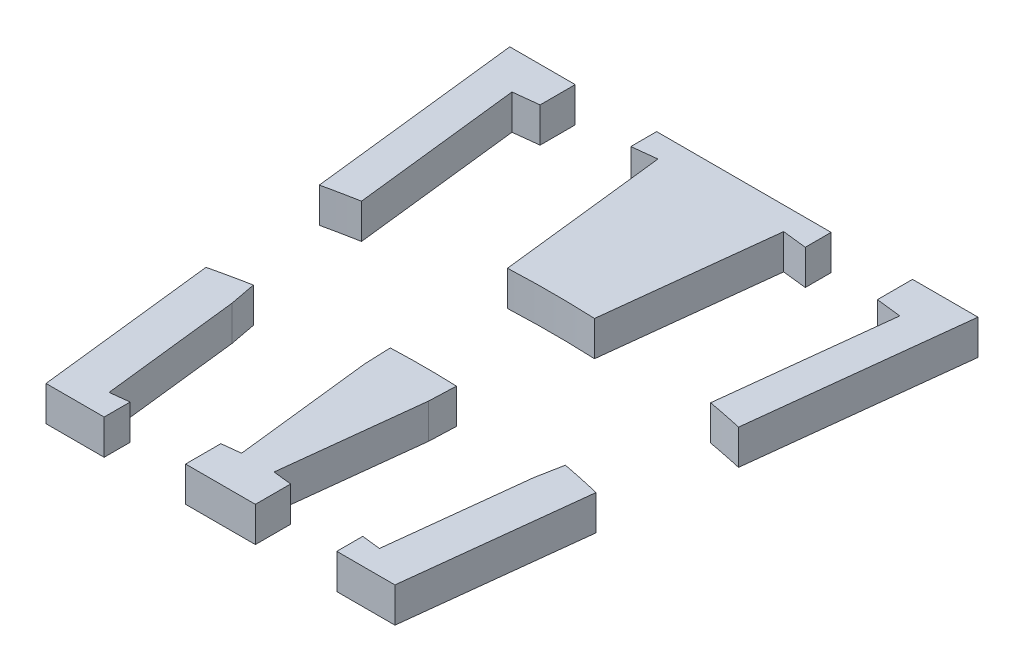
from build123d import *

# Parameters (mm, degrees)
BOSS_EXTRUDE1_DEPTH      = 3
CUT_EXTRUDE1_DEPTH       = 102.55958965
BOSS_EXTRUDE2_DEPTH      = 3
CUT_EXTRUDE7_DEPTH       = 102.55958965
CUT_EXTRUDE9_DEPTH       = 102.55958965
MIRROR10_DEPTH           = 3
CUT_EXTRUDE10_DEPTH      = 102.55958965
CUT_EXTRUDE10_DEPTH_BACK = 102.55958965


# Read off the part's stored shape, not the designer's step: Mirror10
with BuildPart() as part:
    # Sketch1 → Boss-Extrude1 (new body)
    with BuildSketch(Plane(origin=(0, 0, 0), x_dir=(1, 0, 0), z_dir=(0, 1, 0))):
        Polygon((-20.127102374, 99.5), (-15, 54.5), (0, 54.5), (0, 99.5), align=None)
    extrude(amount=BOSS_EXTRUDE1_DEPTH)

    # Sketch2 → Cut-Extrude1 (cut, symmetric)
    with BuildSketch(Plane(origin=(0, 3, 0), x_dir=(1, 0, 0), z_dir=(0, 1, 0))):
        Polygon((-12.142737213, 56.488519479), (-0.87563237, 57.772243923), (-5.403760921, 97.515118151), (-16.670865764, 96.231393706), align=None)
    extrude(amount=CUT_EXTRUDE1_DEPTH, both=True, mode=Mode.SUBTRACT)

    # Sketch6 → Boss-Extrude2 (add)
    with BuildSketch(Plane(origin=(0, 3, 0), x_dir=(1, 0, 0), z_dir=(0, 1, 0))):
        Polygon((-12.142737213, 56.488519479), (-11.621111989, 56.547951167), (-12.979550554, 68.470813435), (-14.293598275, 75.366384737), align=None)
    boss_extrude2 = extrude(amount=-BOSS_EXTRUDE2_DEPTH)

    # Mirror3: Boss-Extrude2 across plane
    add(boss_extrude2.mirror(Plane(origin=(0, 0, 0), x_dir=(0.11320321376790746, 0, 0.9935718556765873), z_dir=(0.9935718556765875, 0, -0.11320321376790746))))

    # Sketch7 → Cut-Extrude7 (cut, symmetric)
    with BuildSketch(Plane(origin=(0, 3, 0), x_dir=(1, 0, 0), z_dir=(0, 1, 0))):
        Polygon((-14.5, 99.5), (-14.5, 96.478732618), (-7.5, 97.276281876), (-7.5, 99.5), align=None)
    extrude(amount=CUT_EXTRUDE7_DEPTH, both=True, mode=Mode.SUBTRACT)

    # Sketch14 → Cut-Extrude9 (cut, symmetric)
    with BuildSketch(Plane(origin=(0, 3, 0), x_dir=(1, 0, 0), z_dir=(0, 1, 0))):
        Polygon((-10, 56.732653547), (-10, 54.5), (-3, 54.5), (-3, 57.530202805), align=None)
    extrude(amount=CUT_EXTRUDE9_DEPTH, both=True, mode=Mode.SUBTRACT)


with BuildPart() as cut_extrude9_piece_1:
    # of the separate pieces the step leaves, piece 1, a body of its own (cut_extrude9_pieces)
    add(part.part.solids().sort_by_distance((-20.127102374, 0, -99.5))[0])


with BuildPart() as cut_extrude9_piece_2:
    # of the separate pieces the step leaves, piece 2, a body of its own (cut_extrude9_pieces)
    add(part.part.solids().sort_by_distance((-3, 0, -54.5))[0])

    # Mirror10 outline → Mirror10 (add)
    with BuildSketch(Plane(origin=(0, 0, 0), x_dir=(1, 0, 0), z_dir=(0, 1, 0))):
        Polygon((0, 54.5), (3, 54.5), (3, 57.530202805), (1.397257594, 57.712812236), (2.755696159, 69.635674504), (3.026493432, 76.650109181), (5.403760921, 97.515118151), (7.5, 97.276281876), (7.5, 99.5), (0, 99.5), align=None)
    extrude(amount=MIRROR10_DEPTH)


with BuildPart() as cut_extrude10_tool:
    # Sketch15 → Cut-Extrude10 (new, two sides: drawn at the far end of the back side and taken through both)
    with BuildSketch(Plane(origin=(0, 3, 0), x_dir=(1, 0, 0), z_dir=(0, 1, 0)).offset(-CUT_EXTRUDE10_DEPTH_BACK)):
        with BuildLine():
            Line((3.740364835, 82.915678077), (3.026493432, 76.650109181))
            Line((3.026493432, 76.650109181), (2.844802122, 71.94377736))
            ThreePointArc((2.844802122, 71.94377736), (-7.02787413, 71.656185952), (-16.768299937, 70.02016936))
            Line((-16.768299937, 70.02016936), (-18.021560353, 81.019894856))
            ThreePointArc((-18.021560353, 81.019894856), (-7.203237804, 82.686839129), (3.740364835, 82.915678077))
        make_face()
    extrude(amount=CUT_EXTRUDE10_DEPTH + CUT_EXTRUDE10_DEPTH_BACK)


with BuildPart() as cut_extrude9_piece_1_1:
    add(cut_extrude9_piece_1.part)

    # Cut-Extrude10: cut by cut_extrude10_tool
    add(cut_extrude10_tool.part, mode=Mode.SUBTRACT)


with BuildPart() as cut_extrude9_piece_2_1:
    add(cut_extrude9_piece_2.part)

    # Cut-Extrude10: cut by cut_extrude10_tool
    add(cut_extrude10_tool.part, mode=Mode.SUBTRACT)


with BuildPart() as cut_extrude10_piece_1:
    # of the separate pieces the step leaves, piece 1, a body of its own (cut_extrude10_pieces)
    add(cut_extrude9_piece_1_1.part.solids().sort_by_distance((-20.127102374, 0, -99.5))[0])


with BuildPart() as cut_extrude10_piece_2:
    # of the separate pieces the step leaves, piece 2, a body of its own (cut_extrude10_pieces)
    add(cut_extrude9_piece_1_1.part.solids().sort_by_distance((-16.768299937, 0, -70.02016936))[0])


with BuildPart() as cut_extrude10_piece_1_of_cut_extrude9_pi:
    # of the separate pieces the step leaves, piece 1, a body of its own (cut_extrude10_pieces_of_cut_extrude9_pie)
    add(cut_extrude9_piece_2_1.part.solids().sort_by_distance((-3.740364835, 0, -82.915678077))[0])


with BuildPart() as cut_extrude10_piece_2_of_cut_extrude9_pi:
    # of the separate pieces the step leaves, piece 2, a body of its own (cut_extrude10_pieces_of_cut_extrude9_pie)
    add(cut_extrude9_piece_2_1.part.solids().sort_by_distance((-3, 0, -54.5))[0])


with BuildPart() as body_5:
    # Mirror13: mirrored copy
    add(cut_extrude10_piece_1.part.mirror(Plane(origin=(0, 0, 0), x_dir=(0, 0, 1), z_dir=(1, 0, 0))))


with BuildPart() as body_6:
    # Mirror13 2: mirrored copy
    add(cut_extrude10_piece_2.part.mirror(Plane(origin=(0, 0, 0), x_dir=(0, 0, 1), z_dir=(1, 0, 0))))


solid = Compound([cut_extrude10_piece_1.part, cut_extrude10_piece_2.part, cut_extrude10_piece_1_of_cut_extrude9_pi.part, cut_extrude10_piece_2_of_cut_extrude9_pi.part, body_5.part, body_6.part])
